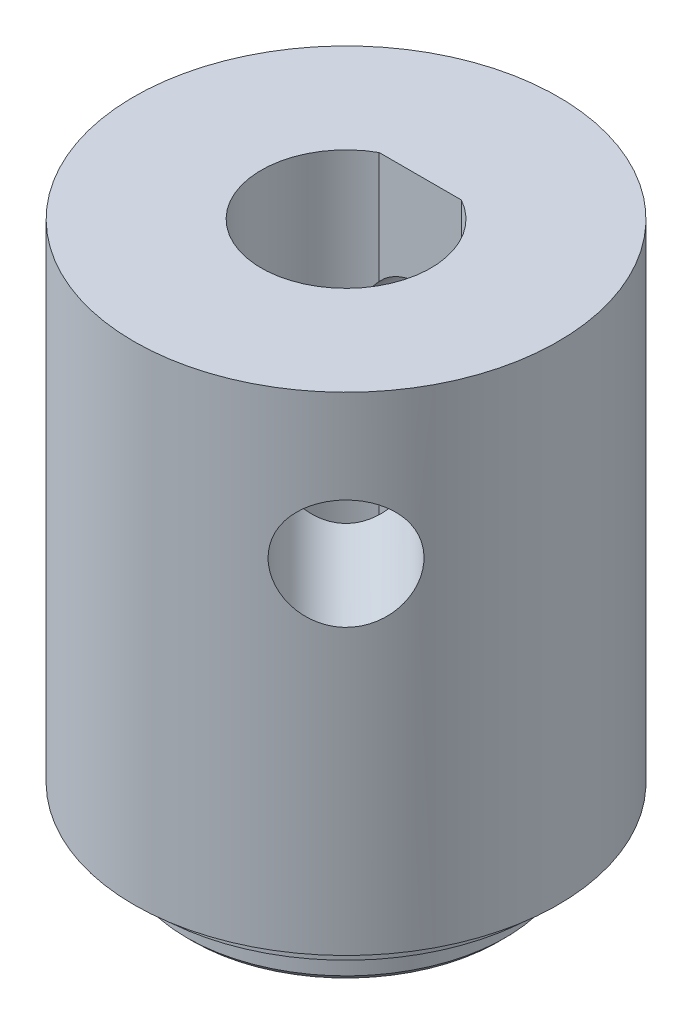
from build123d import *

# Parameters (mm, degrees)
SKETCH1_R             = 7.5
BOSS_EXTRUDE1_DEPTH   = 2
SKETCH2_R             = 9
BOSS_EXTRUDE2_DEPTH   = 0.9
SKETCH3_R             = 10
BOSS_EXTRUDE3_DEPTH   = 23
SKETCH5_R             = 2.1
CUT_EXTRUDE1_DEPTH    = 5.5
CUT_EXTRUDE2_DEPTH    = 20
SKETCH7_R             = 2.6
CUT_EXTRUDE3_DEPTH    = 30.509489999
CIRPATTERN1_START     = 3.039736726
CIRPATTERN1_OUTLINE_R = 2.6
CIRPATTERN1_DEPTH     = 6.960263374
CHAMFER1_SIZE         = 0.3


# Read off the part's stored shape, not the designer's step: CirPattern1
with BuildPart() as part:
    # Sketch1 → Boss-Extrude1 (new body)
    with BuildSketch(Plane(origin=(0, 0, 0), x_dir=(1, 0, 0), z_dir=(0, 1, 0))):
        with Locations(Location((0, 0, 0), (0, 0, 270))):
            Circle(SKETCH1_R)
    extrude(amount=BOSS_EXTRUDE1_DEPTH)

    # Sketch2 → Boss-Extrude2 (add)
    with BuildSketch(Plane(origin=(0, 2, 0), x_dir=(1, 0, 0), z_dir=(0, 1, 0))):
        with Locations(Location((0, 0, 0), (0, 0, 270))):
            Circle(SKETCH2_R)
    extrude(amount=BOSS_EXTRUDE2_DEPTH)

    # Sketch3 → Boss-Extrude3 (add)
    with BuildSketch(Plane(origin=(0, 2.9, 0), x_dir=(1, 0, 0), z_dir=(0, 1, 0))):
        with Locations(Location((0, 0, 0), (0, 0, 270))):
            Circle(SKETCH3_R)
    extrude(amount=BOSS_EXTRUDE3_DEPTH)

    # Sketch5 → Cut-Extrude1 (cut)
    with BuildSketch(Plane.XZ):
        with Locations(Location((4, 0, 0), (0, 0, 270))):
            Circle(SKETCH5_R)
        with Locations(Location((-2, -3.464101615, 0), (0, 0, 270))):
            Circle(SKETCH5_R)
        with Locations(Location((-2, 3.464101615, 0), (0, 0, 270))):
            Circle(SKETCH5_R)
    extrude(amount=-CUT_EXTRUDE1_DEPTH, mode=Mode.SUBTRACT)

    # Sketch6 → Cut-Extrude2 (cut)
    with BuildSketch(Plane(origin=(0, 25.9, 0), x_dir=(1, 0, 0), z_dir=(0, 1, 0))):
        with BuildLine():
            Line((-1.936491673, 3.5), (1.936491673, 3.5))
            ThreePointArc((1.936491673, 3.5), (0, -4), (-1.936491673, 3.5))
        make_face()
    extrude(amount=-CUT_EXTRUDE2_DEPTH, mode=Mode.SUBTRACT)

    # Sketch7 → Cut-Extrude3 (cut, through all)
    with BuildSketch(Plane.XY):
        with Locations(Location((0, 18.9, 0), (0, 0, 318.14230882))):
            Circle(SKETCH7_R)
    extrude(amount=-CUT_EXTRUDE3_DEPTH, mode=Mode.SUBTRACT)

    # CirPattern1 outline → CirPattern1 (cut)
    with BuildSketch(Plane(origin=(0, 0, 0), x_dir=(0.7071067811865509, 0, -0.707106781186544), z_dir=(0.707106781186544, 0, 0.707106781186551)).offset(CIRPATTERN1_START)):
        with Locations((0, 18.9)):
            Circle(CIRPATTERN1_OUTLINE_R)
    extrude(amount=CIRPATTERN1_DEPTH, mode=Mode.SUBTRACT)

    # Chamfer1
    chamfer1_edges = [part.edges().sort_by_distance(p)[0] for p in [
        (0, 0, -7.5),
    ]]
    chamfer(chamfer1_edges, length=CHAMFER1_SIZE)


solid = part.part
